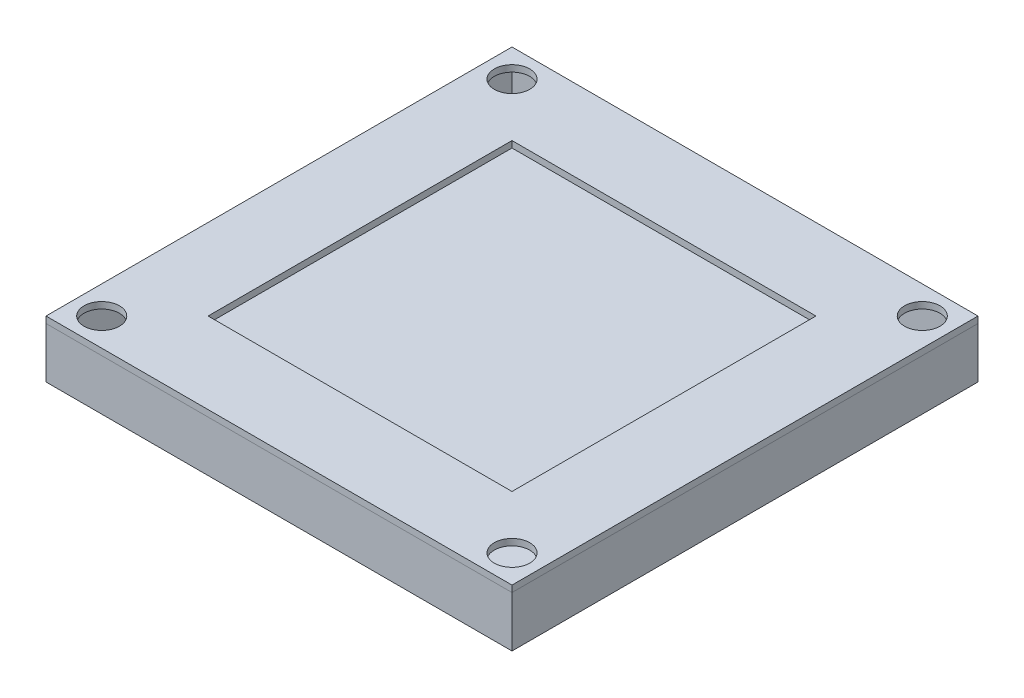
from build123d import *

# Parameters (mm, degrees)
SKETCH1_W           = 292.1
SKETCH1_H           = 292.1
SKETCH1_W_2         = 283.972
SKETCH1_H_2         = 283.972
BOSS_EXTRUDE1_DEPTH = 31.75
SKETCH2_W           = 292.1
SKETCH2_H           = 292.1
BOSS_EXTRUDE2_DEPTH = 1.524
SKETCH3_W           = 292.1
SKETCH3_H           = 292.1
SKETCH3_R           = 11.1125
SKETCH3_W_2         = 190.5
SKETCH3_H_2         = 190.5
BOSS_EXTRUDE3_DEPTH = 4.064


with BuildPart() as part:
    # Sketch1 → Boss-Extrude1 (new body)
    with BuildSketch(Plane(origin=(0, 0, 0), x_dir=(1, 0, 0), z_dir=(0, 1, 0))):
        Rectangle(SKETCH1_W, SKETCH1_H)
        Rectangle(SKETCH1_W_2, SKETCH1_H_2, mode=Mode.SUBTRACT)
    extrude(amount=BOSS_EXTRUDE1_DEPTH)

    # Sketch2 → Boss-Extrude2 (add)
    with BuildSketch(Plane.XZ):
        Rectangle(SKETCH2_W, SKETCH2_H)
    extrude(amount=-BOSS_EXTRUDE2_DEPTH)


with BuildPart() as body_2:
    # Sketch3 → Boss-Extrude3 (new body)
    with BuildSketch(Plane(origin=(0, 31.75, 0), x_dir=(1, 0, 0), z_dir=(0, 1, 0))):
        Rectangle(SKETCH3_W, SKETCH3_H)
        with Locations((-128.5875, 128.5875)):
            Circle(SKETCH3_R, mode=Mode.SUBTRACT)
        with Locations((-128.5875, -128.5875)):
            Circle(SKETCH3_R, mode=Mode.SUBTRACT)
        with Locations((128.5875, -128.5875)):
            Circle(SKETCH3_R, mode=Mode.SUBTRACT)
        with Locations((128.5875, 128.5875)):
            Circle(SKETCH3_R, mode=Mode.SUBTRACT)
        Rectangle(SKETCH3_W_2, SKETCH3_H_2, mode=Mode.SUBTRACT)
    extrude(amount=BOSS_EXTRUDE3_DEPTH)


solid = Compound([part.part, body_2.part])
